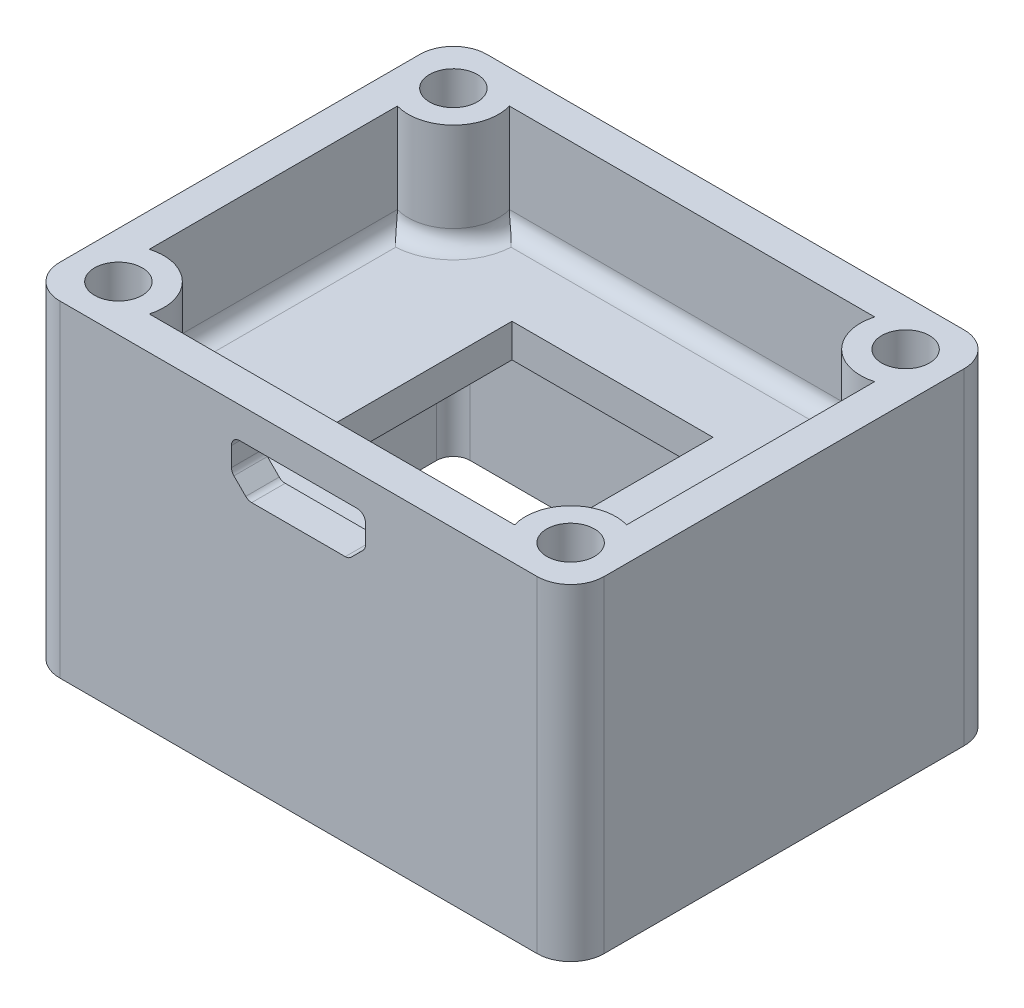
from build123d import *

# Parameters (mm, degrees)
SKETCH_1_W          = 32.5
SKETCH_1_H          = 25.5
SKETCH_1_W_2        = 28.5
SKETCH_1_H_2        = 21.5
EXTRUDE_1_DEPTH     = 13.2
SKETCH_2_W          = 28.5
SKETCH_2_H          = 21.5
SKETCH_2_W_2        = 12
SKETCH_2_H_2        = 12
EXTRUDE_2_DEPTH     = 2
EXTRUDE_3_DEPTH     = 6.3
EXTRUDE_4_REACH     = 30.406
SKETCH_6_R          = 2.7
SKETCH_7_R          = 1.425
CUT_EXTRUDE_3_DEPTH = 5.5
SKETCH_10_W         = 15.8
SKETCH_10_H         = 15.8
SKETCH_10_W_2       = 14.2
SKETCH_10_H_2       = 14.2
EXTRUDE_5_DEPTH     = 0.8
CUT_EXTRUDE_5_DEPTH = 3
FILLET_6_R          = 0.5
FILLET_3_R          = 0.95
FILLET_1_R          = 2
FILLET_2_R          = 1


with BuildPart() as part:
    # 草图1 → 凸台-拉伸1 (new body)
    with BuildSketch(Plane(origin=(0, 0, 0), x_dir=(1, 0, 0), z_dir=(0, 1, 0))):
        Rectangle(SKETCH_1_W, SKETCH_1_H)
        Rectangle(SKETCH_1_W_2, SKETCH_1_H_2, mode=Mode.SUBTRACT)
    extrude(amount=EXTRUDE_1_DEPTH)

    # 草图2 → 凸台-拉伸2 (add)
    with BuildSketch(Plane(origin=(0, 13.2, 0), x_dir=(1, 0, 0), z_dir=(0, 1, 0))):
        Rectangle(SKETCH_2_W, SKETCH_2_H)
        Rectangle(SKETCH_2_W_2, SKETCH_2_H_2, mode=Mode.SUBTRACT)
    extrude(amount=-EXTRUDE_2_DEPTH)

    # 草图3 → 凸台-拉伸3 (add)
    with BuildSketch(Plane(origin=(0, 13.2, 0), x_dir=(1, 0, 0), z_dir=(0, 1, 0))):
        Polygon((-16.25, -12.75), (-16.25, 12.75), (16.25, 12.75), (16.25, -0.040360215), (16.25, -12.75), align=None)
        Polygon((14.25, 0.013681835), (14.25, 10.75), (-14.25, 10.75), (-14.25, -10.75), (14.25, -10.75), align=None, mode=Mode.SUBTRACT)
    extrude(amount=EXTRUDE_3_DEPTH)

    # 草图6 → 凸台-拉伸4 (add, up to next)
    with BuildSketch(Plane(origin=(0, 19.5, 0), x_dir=(1, 0, 0), z_dir=(0, 1, 0)), mode=Mode.PRIVATE) as extrude_4_sk1:
        with Locations((13.5, 10)):
            Circle(SKETCH_6_R)
    extrude_4_tool1 = extrude(extrude_4_sk1.sketch, amount=-EXTRUDE_4_REACH, mode=Mode.PRIVATE) - part.part
    # 草图6 → 凸台-拉伸4 (add, up to next)
    with BuildSketch(Plane(origin=(0, 19.5, 0), x_dir=(1, 0, 0), z_dir=(0, 1, 0)), mode=Mode.PRIVATE) as extrude_4_sk2:
        with Locations((13.5, -10)):
            Circle(SKETCH_6_R)
    extrude_4_tool2 = extrude(extrude_4_sk2.sketch, amount=-EXTRUDE_4_REACH, mode=Mode.PRIVATE) - part.part
    # 草图6 → 凸台-拉伸4 (add, up to next)
    with BuildSketch(Plane(origin=(0, 19.5, 0), x_dir=(1, 0, 0), z_dir=(0, 1, 0)), mode=Mode.PRIVATE) as extrude_4_sk3:
        with Locations((-13.5, -10)):
            Circle(SKETCH_6_R)
    extrude_4_tool3 = extrude(extrude_4_sk3.sketch, amount=-EXTRUDE_4_REACH, mode=Mode.PRIVATE) - part.part
    # 草图6 → 凸台-拉伸4 (add, up to next)
    with BuildSketch(Plane(origin=(0, 19.5, 0), x_dir=(1, 0, 0), z_dir=(0, 1, 0)), mode=Mode.PRIVATE) as extrude_4_sk4:
        with Locations((-13.5, 10)):
            Circle(SKETCH_6_R)
    extrude_4_tool4 = extrude(extrude_4_sk4.sketch, amount=-EXTRUDE_4_REACH, mode=Mode.PRIVATE) - part.part
    add(extrude_4_tool1.solids().sort_by_distance((13.5, 19.5, -10))[0])
    add(extrude_4_tool2.solids().sort_by_distance((13.5, 19.5, 10))[0])
    add(extrude_4_tool3.solids().sort_by_distance((-13.5, 19.5, 10))[0])
    add(extrude_4_tool4.solids().sort_by_distance((-13.5, 19.5, -10))[0])

    # 草图7 → 切除-拉伸3 (cut)
    with BuildSketch(Plane(origin=(0, 19.5, 0), x_dir=(1, 0, 0), z_dir=(0, 1, 0))):
        with Locations((13.5, 10)):
            Circle(SKETCH_7_R)
        with Locations((13.5, -10)):
            Circle(SKETCH_7_R)
        with Locations((-13.5, -10)):
            Circle(SKETCH_7_R)
        with Locations((-13.5, 10)):
            Circle(SKETCH_7_R)
    extrude(amount=-CUT_EXTRUDE_3_DEPTH, mode=Mode.SUBTRACT)

    # 草图10 → 凸台-拉伸5 (add)
    with BuildSketch(Plane.XZ.offset(-11.2)):
        Rectangle(SKETCH_10_W, SKETCH_10_H)
        Rectangle(SKETCH_10_W_2, SKETCH_10_H_2, mode=Mode.SUBTRACT)
    extrude(amount=EXTRUDE_5_DEPTH)

    # 草图11 → 切除-拉伸5 (cut)
    with BuildSketch(Plane.XY.offset(12.75)):
        Polygon((-4, 17.65), (4, 17.65), (4, 15.8), (3, 14.8), (-3, 14.8), (-4, 15.8), align=None)
    extrude(amount=-CUT_EXTRUDE_5_DEPTH, mode=Mode.SUBTRACT)

    # 圆角6
    fillet_6_edges = [part.edges().sort_by_distance(p)[0] for p in [
        (4, 15.8, 11.75),
        (3, 14.8, 11.75),
        (-3, 14.8, 11.75),
        (-4, 15.8, 11.75),
        (-4, 17.65, 11.75),
        (4, 17.65, 11.75),
    ]]
    fillet(fillet_6_edges, radius=FILLET_6_R)

    # 圆角3
    fillet_3_edges = [part.edges().sort_by_distance(p)[0] for p in [
        (0, 13.2, -10.75),
        (11.590811691, 13.2, -8.090811691),
        (11.590811691, 13.2, 8.090811691),
        (0, 13.2, 10.75),
        (-11.590811691, 13.2, 8.090811691),
        (-14.25, 13.2, 0),
        (-11.590811691, 13.2, -8.090811691),
        (14.25, 13.2, 0),
    ]]
    fillet(fillet_3_edges, radius=FILLET_3_R)

    # 圆角1
    fillet_1_edges = [part.edges().sort_by_distance(p)[0] for p in [
        (16.25, 9.75, -12.75),
        (-16.25, 9.75, 12.75),
        (16.25, 9.75, 12.75),
        (-16.25, 9.75, -12.75),
    ]]
    fillet(fillet_1_edges, radius=FILLET_1_R)

    # 圆角2
    fillet_2_edges = [part.edges().sort_by_distance(p)[0] for p in [
        (14.25, 5.6, -10.75),
        (-14.25, 5.6, -10.75),
        (-14.25, 5.6, 10.75),
        (14.25, 5.6, 10.75),
    ]]
    fillet(fillet_2_edges, radius=FILLET_2_R)


solid = part.part
